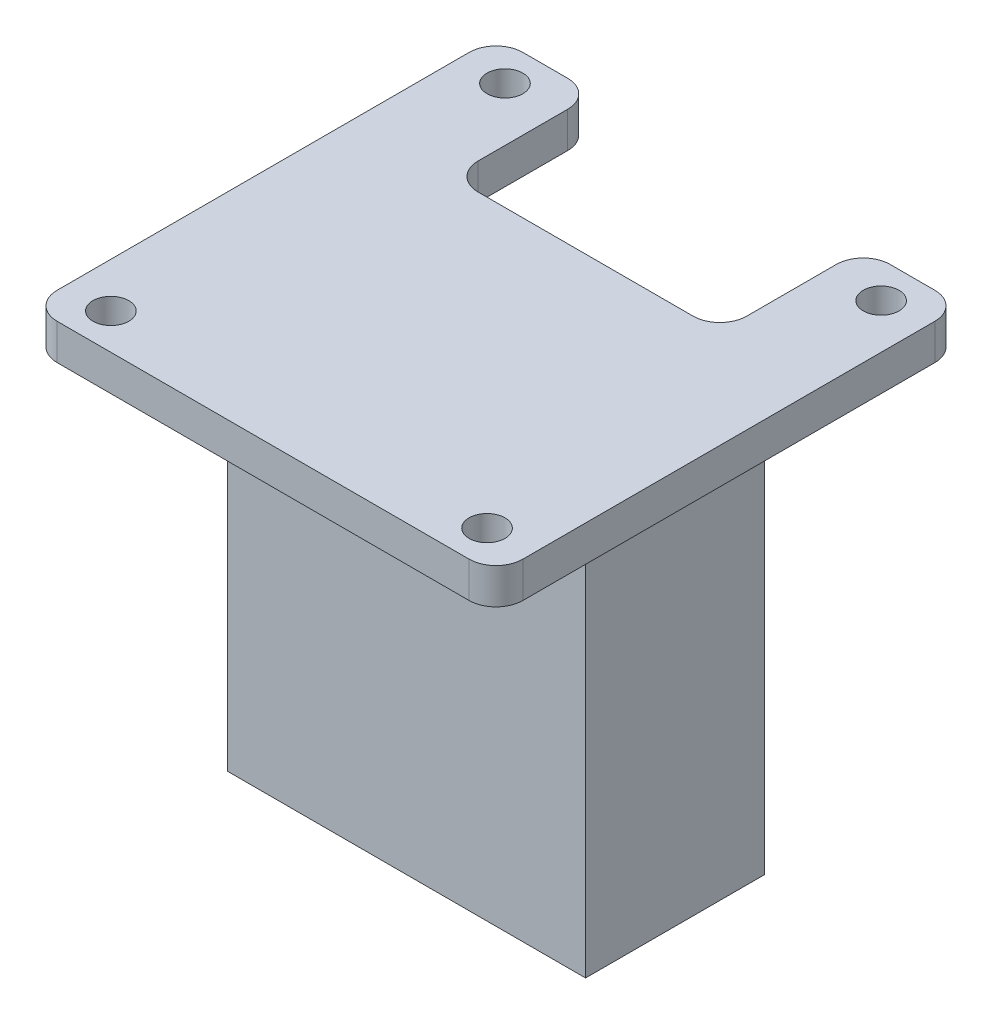
from build123d import *

# Parameters (mm, degrees)
SKETCH_1_W          = 20
SKETCH_1_H          = 10
SKETCH_1_R          = 1.45
EXTRUDE_1_DEPTH     = 23
SKETCH_2_R          = 1
EXTRUDE_2_DEPTH     = 2
SKETCH_3_W          = 15
SKETCH_3_H          = 16
CUT_EXTRUDE_1_DEPTH = 15
FILLET_3_R          = 1.5


with BuildPart() as part:
    # 草图1 → 凸台-拉伸1 (new body)
    with BuildSketch(Plane(origin=(0, 0, 0), x_dir=(1, 0, 0), z_dir=(0, 1, 0))):
        Rectangle(SKETCH_1_W, SKETCH_1_H)
        with Locations(Location((0, 1.5, 0), (0, 0, 270))):
            Circle(SKETCH_1_R, mode=Mode.SUBTRACT)
    extrude(amount=EXTRUDE_1_DEPTH)

    # 草图2 → 凸台-拉伸2 (add)
    with BuildSketch(Plane(origin=(0, 23, 0), x_dir=(1, 0, 0), z_dir=(0, 1, 0))):
        Polygon((13, -13), (0, -13), (-13, -13), (-13, 13), (13, 13), align=None)
        with Locations(Location((-10.5, 11, 0), (0, 0, 270))):
            Circle(SKETCH_2_R, mode=Mode.SUBTRACT)
        with Locations(Location((10.5, 11, 0), (0, 0, 90))):
            Circle(SKETCH_2_R, mode=Mode.SUBTRACT)
        with Locations(Location((10.5, -11, 0), (0, 0, 270))):
            Circle(SKETCH_2_R, mode=Mode.SUBTRACT)
        with Locations(Location((-10.5, -11, 0), (0, 0, 90))):
            Circle(SKETCH_2_R, mode=Mode.SUBTRACT)
    extrude(amount=EXTRUDE_2_DEPTH)

    # 草图3 → 切除-拉伸1 (cut)
    with BuildSketch(Plane(origin=(0, 25, 0), x_dir=(1, 0, 0), z_dir=(0, 1, 0))):
        with Locations((0, 13)):
            Rectangle(SKETCH_3_W, SKETCH_3_H)
    extrude(amount=-CUT_EXTRUDE_1_DEPTH, mode=Mode.SUBTRACT)

    # 圆角3
    fillet_3_edges = [part.edges().sort_by_distance(p)[0] for p in [
        (10, 23, 0),
        (8.75, 23, -5),
        (-13, 24, -13),
        (-13, 24, 13),
        (13, 24, 13),
        (13, 24, -13),
        (7.5, 24, -13),
        (-7.5, 24, -13),
        (-8.75, 23, -5),
        (7.5, 24, -5),
        (-7.5, 24, -5),
        (-10, 23, 0),
        (0, 23, 5),
    ]]
    fillet(fillet_3_edges, radius=FILLET_3_R - 0.0001)  # a hair under: the kernel refuses the full size


solid = part.part
